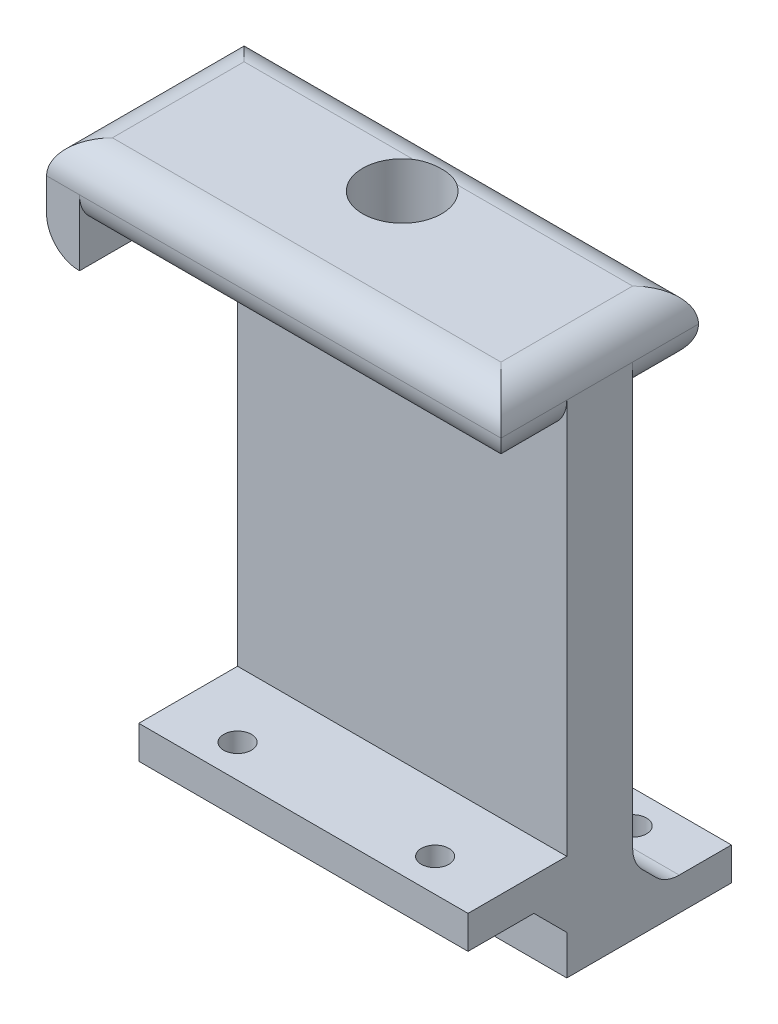
from build123d import *

# Parameters (mm, degrees)
BOSS_EXTRU_1_DEPTH      = 10
BOSS_EXTRU_2_DEPTH      = 10
BOSS_EXTRU_2_DEPTH_BACK = 20
ESQUISSE2_W             = 69
ESQUISSE2_H             = 10
ESQUISSE3_W             = 50
ESQUISSE3_H             = 5
BOSS_EXTRU_3_DEPTH      = 15
CHANFREIN1_SIZE         = 5
ESQUISSE4_R             = 2.1
ENL_V_MAT_EXTRU_1_DEPTH = 15
ESQUISSE5_W             = 30
ESQUISSE5_H             = 5
BOSS_EXTRU_4_DEPTH      = 5
ESQUISSE6_W             = 50
ESQUISSE6_H             = 5
BOSS_EXTRU_5_DEPTH      = 15
CHANFREIN2_SIZE         = 5
ESQUISSE7_R             = 2.1
ENL_V_MAT_EXTRU_2_DEPTH = 15
ESQUISSE8_R             = 6
ENL_V_MAT_EXTRU_3_DEPTH = 20
CONG_1_R                = 5


with BuildPart() as part:
    # Esquisse1 → Boss.-Extru.1 (new body)
    with BuildSketch(Plane.XY):
        Polygon((0, 0), (0, 81), (-69, 81), (-69, 66), (-64, 66), (-64, 71), (-50, 71), (-50, 0), align=None)
    extrude(amount=BOSS_EXTRU_1_DEPTH)

    # Esquisse2 → Boss.-Extru.2 (add, two sides: drawn at the far end of the back side and taken through both)
    with BuildSketch(Plane.XY.offset(10).offset(-BOSS_EXTRU_2_DEPTH_BACK)):
        with Locations((-34.5, 76)):
            Rectangle(ESQUISSE2_W, ESQUISSE2_H)
    extrude(amount=BOSS_EXTRU_2_DEPTH + BOSS_EXTRU_2_DEPTH_BACK)

    # Esquisse3 → Boss.-Extru.3 (add)
    with BuildSketch(Plane(origin=(0, 0, 0), x_dir=(-1, 0, 0), z_dir=(0, 0, -1))):
        with Locations((25, 2.5)):
            Rectangle(ESQUISSE3_W, ESQUISSE3_H)
    extrude(amount=BOSS_EXTRU_3_DEPTH)

    # Chanfrein1
    chanfrein1_edges = [part.edges().sort_by_distance(p)[0] for p in [
        (-25, 5, 0),
    ]]
    chamfer(chanfrein1_edges, length=CHANFREIN1_SIZE)

    # Esquisse4 → Enlèv. mat.-Extru.1 (cut)
    with BuildSketch(Plane(origin=(0, 5, 0), x_dir=(1, 0, 0), z_dir=(0, 1, 0))):
        with Locations(Location((-40, 10, 0), (0, 0, 180))):
            Circle(ESQUISSE4_R)
        with Locations(Location((-10, 10, 0), (0, 0, 180))):
            Circle(ESQUISSE4_R)
    extrude(amount=-ENL_V_MAT_EXTRU_1_DEPTH, mode=Mode.SUBTRACT)

    # Esquisse5 → Boss.-Extru.4 (add)
    with BuildSketch(Plane.ZY.offset(69)):
        with Locations((5, 68.5)):
            Rectangle(ESQUISSE5_W, ESQUISSE5_H)
    extrude(amount=-BOSS_EXTRU_4_DEPTH)

    # Esquisse6 → Boss.-Extru.5 (add)
    with BuildSketch(Plane.XY.offset(10)):
        with Locations((-25, 13.5)):
            Rectangle(ESQUISSE6_W, ESQUISSE6_H)
    extrude(amount=BOSS_EXTRU_5_DEPTH)

    # Chanfrein2
    chanfrein2_edges = [part.edges().sort_by_distance(p)[0] for p in [
        (-25, 11, 10),
    ]]
    chamfer(chanfrein2_edges, length=CHANFREIN2_SIZE)

    # Esquisse7 → Enlèv. mat.-Extru.2 (cut)
    with BuildSketch(Plane.XZ.offset(-11)):
        with Locations((-10, 20)):
            Circle(ESQUISSE7_R)
        with Locations((-40, 20)):
            Circle(ESQUISSE7_R)
    extrude(amount=-ENL_V_MAT_EXTRU_2_DEPTH, mode=Mode.SUBTRACT)

    # Esquisse8 → Enlèv. mat.-Extru.3 (cut)
    with BuildSketch(Plane(origin=(0, 81, 0), x_dir=(1, 0, 0), z_dir=(0, 1, 0))):
        with Locations(Location((-35, 0, 0), (0, 0, 270))):
            Circle(ESQUISSE8_R)
    extrude(amount=-ENL_V_MAT_EXTRU_3_DEPTH, mode=Mode.SUBTRACT)

    # Congé1
    # the kernel refuses this fillet: 5 mm, written as the material it adds along each edge
    with BuildSketch(Plane(origin=(0, 10, 0), x_dir=(0, -0.7071067811865476, -0.7071067811865476), z_dir=(-1, 0, 0)), Plane(origin=(0, 5, -5), x_dir=(0, 0, -1), z_dir=(-1, 0, 0))) as cong_1_piece_1:
        with BuildLine():
            CenterArc((CONG_1_R * 0.414213562373, -CONG_1_R), CONG_1_R, 90, 45)
            Line((-CONG_1_R * 0.292893218813, -CONG_1_R * 0.292893218813), (0, 0))
            Line((0, 0), (CONG_1_R * 0.414213562373, 0))
        make_face()
    extrude(amount=50)
    # the kernel refuses this fillet: 5 mm, written as the material it takes off along each edge
    with BuildSketch(Plane(origin=(-81.5, 81, 20), x_dir=(0, -1, 0), z_dir=(1, 0, 0))) as cong_1_2_piece_1:
        with BuildLine():
            CenterArc((CONG_1_R, CONG_1_R), CONG_1_R, 180, 90)
            Line((0, CONG_1_R), (0, 0))
            Line((0, 0), (CONG_1_R, 0))
        make_face()
    extrude(amount=94, mode=Mode.SUBTRACT)
    with BuildSketch(Plane(origin=(12.5, 71, 20), x_dir=(0, 0, -1), z_dir=(-1, 0, 0))) as cong_1_2_piece_2:
        with BuildLine():
            CenterArc((CONG_1_R, -CONG_1_R), CONG_1_R, 90, 90)
            Line((0, -CONG_1_R), (0, 0))
            Line((0, 0), (CONG_1_R, 0))
        make_face()
    extrude(amount=76.5, mode=Mode.SUBTRACT)
    with BuildSketch(Plane(origin=(0, 71, -2.5), x_dir=(0, 1, 0), z_dir=(0, 0, 1))) as cong_1_2_piece_3_section:
        with BuildLine():
            CenterArc((CONG_1_R, CONG_1_R), CONG_1_R, 180, 90)
            Line((0, CONG_1_R), (0, 0))
            Line((0, 0), (CONG_1_R, 0))
        make_face()
    cong_1_2_piece_3 = extrude(amount=35, mode=Mode.PRIVATE)
    cong_1_2_piece_3 = split(cong_1_2_piece_3, bisect_by=Plane(origin=(-1.116839695, 72.116839695, 0), z_dir=(0, 0, -1)), keep=Keep.TOP, mode=Mode.PRIVATE)
    add(cong_1_2_piece_3, mode=Mode.SUBTRACT)
    with BuildSketch(Plane(origin=(0, 71, 10), x_dir=(0, 1, 0), z_dir=(0, 0, 1)), Plane(origin=(0, 71, -22.5), x_dir=(0, 1, 0), z_dir=(0, 0, 1))) as cong_1_2_piece_4:
        with BuildLine():
            CenterArc((CONG_1_R, CONG_1_R), CONG_1_R, 180, 90)
            Line((0, CONG_1_R), (0, 0))
            Line((0, 0), (CONG_1_R, 0))
        make_face()
    extrude(amount=22.5, mode=Mode.SUBTRACT)
    with BuildSketch(Plane(origin=(0, 71, -22.5), x_dir=(0, 1, 0), z_dir=(0, 0, 1))) as cong_1_2_piece_5_section:
        with BuildLine():
            CenterArc((CONG_1_R, CONG_1_R), CONG_1_R, 180, 90)
            Line((0, CONG_1_R), (0, 0))
            Line((0, 0), (CONG_1_R, 0))
        make_face()
    cong_1_2_piece_5 = extrude(amount=35, mode=Mode.PRIVATE)
    cong_1_2_piece_5 = split(cong_1_2_piece_5, bisect_by=Plane(origin=(-1.116839695, 72.116839695, 10), z_dir=(0, 0, 1)), keep=Keep.TOP, mode=Mode.PRIVATE)
    add(cong_1_2_piece_5, mode=Mode.SUBTRACT)
    with BuildSketch(Plane(origin=(0, 81, -22.5), x_dir=(0, -1, 0), z_dir=(0, 0, 1)), Plane(origin=(-69, 81, -22.5), x_dir=(1, 0, 0), z_dir=(0, 0, 1))) as cong_1_2_piece_6:
        with BuildLine():
            CenterArc((CONG_1_R, -CONG_1_R), CONG_1_R, 90, 90)
            Line((0, -CONG_1_R), (0, 0))
            Line((0, 0), (CONG_1_R, 0))
        make_face()
    extrude(amount=55, mode=Mode.SUBTRACT)
    with BuildSketch(Plane(origin=(12.5, 71, -10), x_dir=(0, 0, 1), z_dir=(-1, 0, 0))) as cong_1_2_piece_7:
        with BuildLine():
            CenterArc((CONG_1_R, CONG_1_R), CONG_1_R, 180, 90)
            Line((0, CONG_1_R), (0, 0))
            Line((0, 0), (CONG_1_R, 0))
        make_face()
    extrude(amount=76.5, mode=Mode.SUBTRACT)
    with BuildSketch(Plane(origin=(-81.5, 81, -10), x_dir=(0, -1, 0), z_dir=(1, 0, 0))) as cong_1_2_piece_8:
        with BuildLine():
            CenterArc((CONG_1_R, -CONG_1_R), CONG_1_R, 90, 90)
            Line((0, -CONG_1_R), (0, 0))
            Line((0, 0), (CONG_1_R, 0))
        make_face()
    extrude(amount=94, mode=Mode.SUBTRACT)
    with BuildSketch(Plane(origin=(-69, 66, -22.5), x_dir=(1, 0, 0), z_dir=(0, 0, 1))) as cong_1_2_piece_9:
        with BuildLine():
            CenterArc((CONG_1_R, CONG_1_R), CONG_1_R, 180, 90)
            Line((0, CONG_1_R), (0, 0))
            Line((0, 0), (CONG_1_R, 0))
        make_face()
    extrude(amount=55, mode=Mode.SUBTRACT)


solid = part.part
